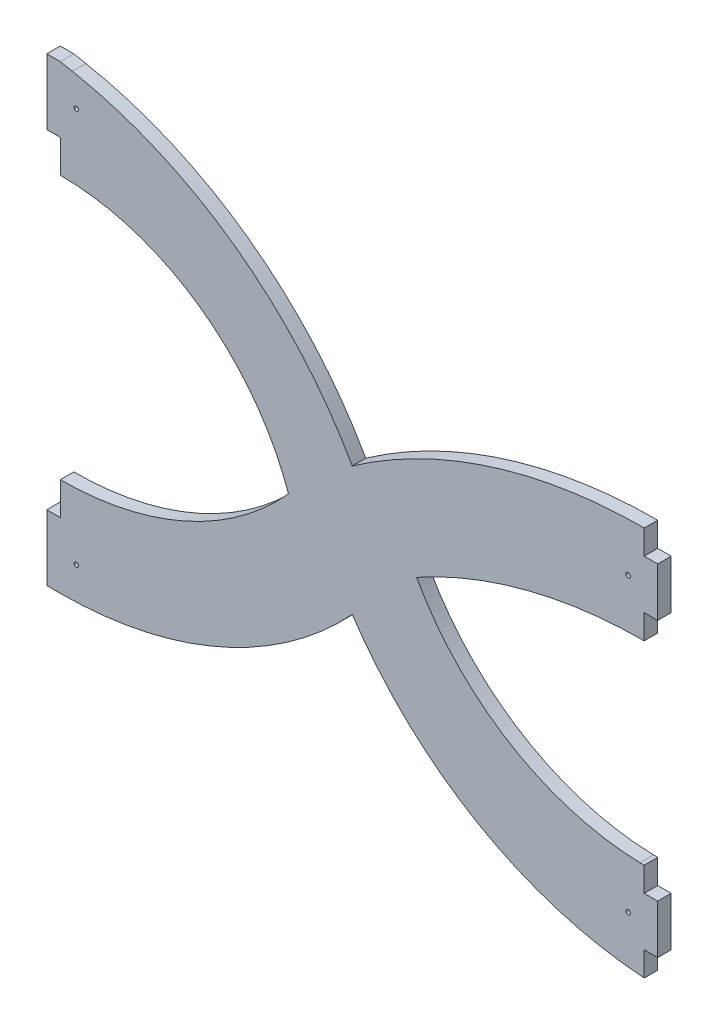
from build123d import *

# Parameters (mm, degrees)
SKETCH1_W           = 241.3
SKETCH1_H           = 198.12
BOSS_EXTRUDE1_DEPTH = 5.334
SKETCH2_W           = 5.334
SKETCH2_H           = 9.652
SKETCH2_H_2         = 96.012
SKETCH2_H_3         = 53.848
CUT_EXTRUDE1_DEPTH  = 179.277190048
SKETCH3_W           = 5.334
SKETCH3_H           = 16.256
SKETCH3_H_2         = 130.048
CUT_EXTRUDE2_DEPTH  = 179.277190048
CUT_EXTRUDE5_DEPTH  = 179.277190048
CUT_EXTRUDE6_DEPTH  = 179.277190048
CUT_EXTRUDE7_DEPTH  = 179.277190048
SKETCH8_R           = 0.889
CUT_EXTRUDE8_DEPTH  = 179.277190048
SKETCH9_R           = 0.889
CUT_EXTRUDE9_DEPTH  = 179.277190048


with BuildPart() as part:
    # Sketch1 → Boss-Extrude1 (new body)
    with BuildSketch(Plane.XY):
        with Locations((-21.329797884, -8.624919689)):
            Rectangle(SKETCH1_W, SKETCH1_H)
    extrude(amount=BOSS_EXTRUDE1_DEPTH)

    # Sketch2 → Cut-Extrude1 (cut, through all)
    with BuildSketch(Plane.XY.offset(5.334)):
        with Locations((96.653202116, -102.858919689)):
            Rectangle(SKETCH2_W, SKETCH2_H)
        with Locations((96.653202116, -30.722919689)):
            Rectangle(SKETCH2_W, SKETCH2_H_2)
        with Locations((96.653202116, 63.511080311)):
            Rectangle(SKETCH2_W, SKETCH2_H_3)
    extrude(amount=-CUT_EXTRUDE1_DEPTH, mode=Mode.SUBTRACT)

    # Sketch3 → Cut-Extrude2 (cut, through all)
    with BuildSketch(Plane.XY.offset(5.334)):
        with Locations((-139.312797884, -99.556919689)):
            Rectangle(SKETCH3_W, SKETCH3_H)
        with Locations((-139.312797884, -0.496919689)):
            Rectangle(SKETCH3_W, SKETCH3_H_2)
    extrude(amount=-CUT_EXTRUDE2_DEPTH, mode=Mode.SUBTRACT)

    # Sketch5 → Cut-Extrude5 (cut, through all)
    with BuildSketch(Plane.XY.offset(5.334)):
        Polygon((-136.645797884, -91.428919689), (93.986202116, -107.684919689), (93.986202116, -162.860416997), (-136.645797884, -146.604416997), align=None)
    extrude(amount=-CUT_EXTRUDE5_DEPTH, mode=Mode.SUBTRACT)

    # Sketch6 → Cut-Extrude6 (cut, through all)
    with BuildSketch(Plane.XY.offset(5.334)):
        Polygon((-136.645797884, 90.435080311), (93.986202116, 46.239080311), (93.986202116, 90.435080311), (-136.645797884, 134.631080311), align=None)
    extrude(amount=-CUT_EXTRUDE6_DEPTH, mode=Mode.SUBTRACT)

    # Sketch7 → Cut-Extrude7 (cut, through all)
    with BuildSketch(Plane.XY.offset(5.334)):
        with BuildLine():
            Line((-131.856906834, 89.51738533), (93.986202116, 46.239080311))
            ThreePointArc((93.986202116, 46.239080311), (33.516562096, 36.909943164), (-21.329797884, 9.790080311))
            ThreePointArc((-21.329797884, 9.790080311), (-67.771765334, 61.883225714), (-131.856906834, 89.51738533))
        make_face()
        with BuildLine():
            Line((-136.645797884, -91.428919689), (93.309248095, -107.637204869))
            ThreePointArc((93.309248095, -107.637204869), (28.257925694, -87.626912489), (-21.329797884, -41.009919689))
            ThreePointArc((-21.329797884, -41.009919689), (-73.717554191, -78.2732768), (-136.645797884, -91.428919689))
        make_face()
        with BuildLine():
            ThreePointArc((93.986202116, 7.631080311), (47.550679246, 1.726898301), (4.070202116, -15.609919689))
            ThreePointArc((4.070202116, -15.609919689), (41.092439587, -54.093369858), (92.347831876, -69.076919689))
            ThreePointArc((92.347831876, -69.076919689), (131.631647498, -31.544467715), (93.986202116, 7.631080311))
        make_face()
        with BuildLine():
            ThreePointArc((-136.645797884, 51.573080311), (-81.408536453, 33.982932584), (-46.514432981, -12.3092902))
            ThreePointArc((-46.514432981, -12.3092902), (-87.289086913, -42.04513502), (-136.645797884, -52.566919689))
            ThreePointArc((-136.645797884, -52.566919689), (-188.715797884, -0.496919689), (-136.645797884, 51.573080311))
        make_face()
    extrude(amount=-CUT_EXTRUDE7_DEPTH, mode=Mode.SUBTRACT)

    # Sketch8 → Cut-Extrude8 (cut, through all)
    with BuildSketch(Plane.XY.offset(5.334)):
        with Locations((-130.295797884, 77.481080311)):
            Circle(SKETCH8_R)
        with Locations((-130.295797884, -78.474919689)):
            Circle(SKETCH8_R)
    extrude(amount=-CUT_EXTRUDE8_DEPTH, mode=Mode.SUBTRACT)

    # Sketch9 → Cut-Extrude9 (cut, through all)
    with BuildSketch(Plane.XY.offset(5.334)):
        with Locations((87.636202116, 26.935080311)):
            Circle(SKETCH9_R)
        with Locations((87.636202116, -88.380919689)):
            Circle(SKETCH9_R)
    extrude(amount=-CUT_EXTRUDE9_DEPTH, mode=Mode.SUBTRACT)


solid = part.part
